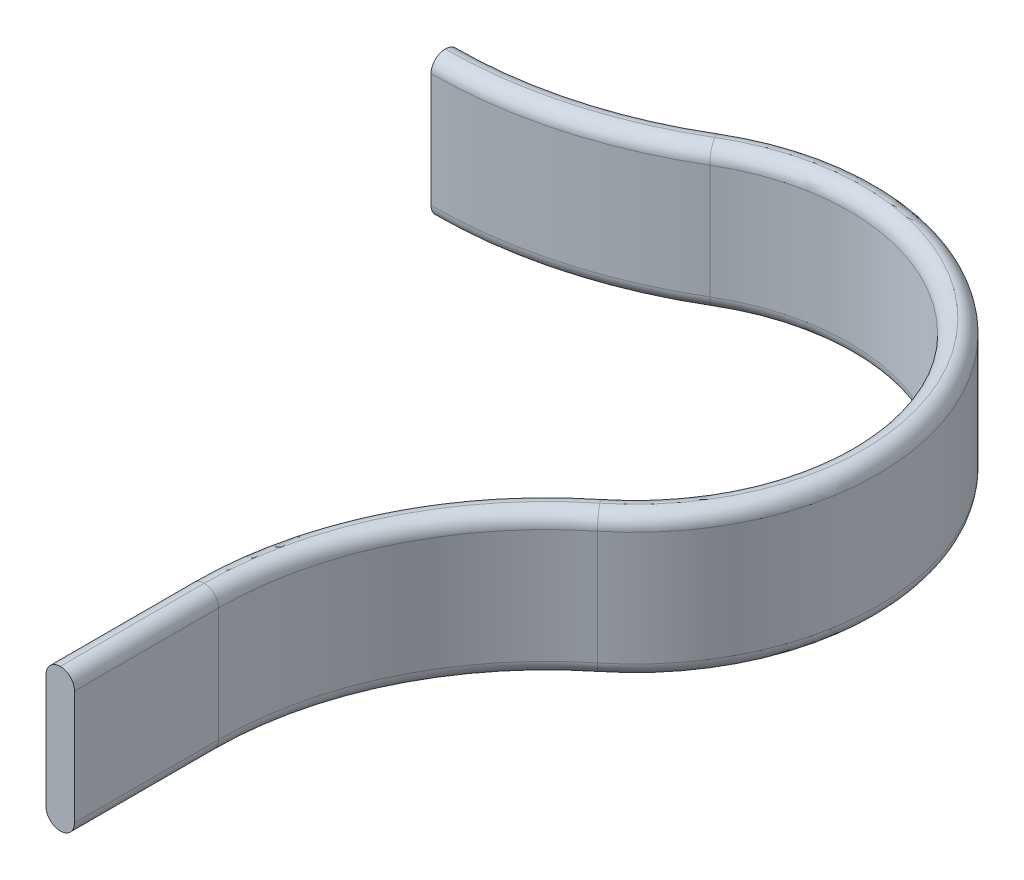
from build123d import *

# Parameters (mm, degrees)
BOSS_EXTRUDE1_DEPTH = 10
FILLET1_R           = 2


with BuildPart() as part:
    # Sketch1 → Boss-Extrude1 (new, symmetric)
    with BuildSketch(Plane(origin=(0, 0, 0), x_dir=(1, 0, 0), z_dir=(0, 1, 0))):
        with BuildLine():
            Line((4, -79.806298407), (4, -100))
            Line((4, -100), (0, -100))
            Line((0, -100), (0, -79.806298407))
            ThreePointArc((0, -79.806298407), (4.930609057, -58.155663313), (18.75, -40.775060917))
            ThreePointArc((18.75, -40.775060917), (24.661331748, -0.273616166), (-15.333333333, 8.429121051))
            ThreePointArc((-15.333333333, 8.429121051), (-30.097999134, 2.145645207), (-46, 0))
            Line((-46, 0), (-46, 4))
            ThreePointArc((-46, 4), (-31.158132525, 6.002602194), (-17.377777778, 11.867179648))
            ThreePointArc((-17.377777778, 11.867179648), (27.949509314, 2.004077469), (21.25, -43.897559916))
            ThreePointArc((21.25, -43.897559916), (8.536160332, -59.88771412), (4, -79.806298407))
        make_face()
    extrude(amount=BOSS_EXTRUDE1_DEPTH, both=True)

    # Fillet1
    fillet1_edges = [part.edges().sort_by_distance(p)[0] for p in [
        (0, -10, 89.903149204),
        (4.930609057, -10, 58.155663313),
        (24.661331748, -10, 0.273616166),
        (4, -10, 89.903149204),
        (8.536160332, -10, 59.88771412),
        (27.949509314, -10, -2.004077469),
        (0, 10, 89.903149204),
        (4.930609057, 10, 58.155663313),
        (24.661331748, 10, 0.273616166),
        (4, 10, 89.903149204),
        (8.536160332, 10, 59.88771412),
        (27.949509314, 10, -2.004077469),
        (-30.097999134, -10, -2.145645207),
        (-31.158132525, -10, -6.002602194),
        (-30.097999134, 10, -2.145645207),
        (-31.158132525, 10, -6.002602194),
    ]]
    fillet(fillet1_edges, radius=FILLET1_R - 0.0001)  # a hair under: the kernel refuses the full size


solid = part.part
